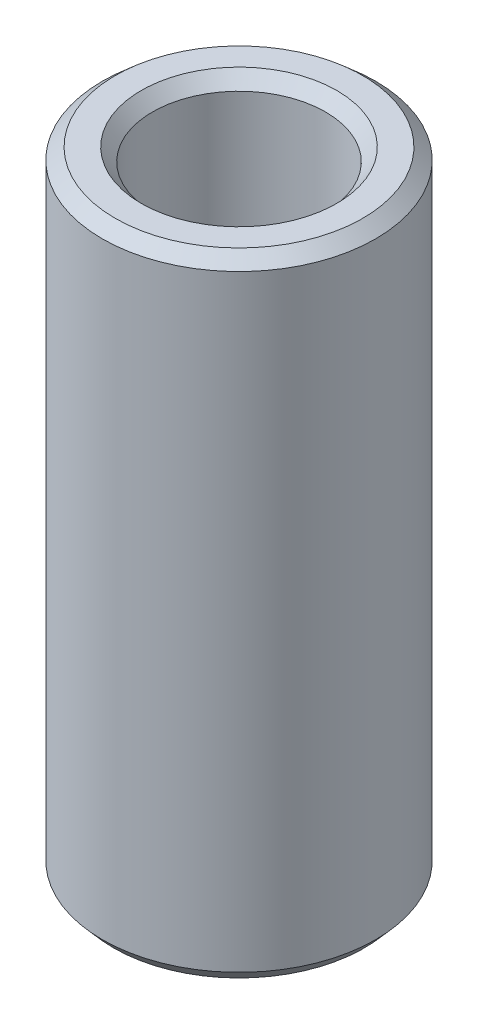
from build123d import *
from OCP.BRepFilletAPI import BRepFilletAPI_MakeChamfer

# Parameters (mm, degrees)
SKETCH1_R           = 47.5
BOSS_EXTRUDE1_DEPTH = 219.440858252
SKETCH2_R           = 30.078602804
CUT_EXTRUDE1_DEPTH  = 230.492462339
CHAMFER1_SIZE       = 3.9352616
CHAMFER1_SIZE2      = 4.482066112


with BuildPart() as part:
    # Sketch1 → Boss-Extrude1 (new body)
    with BuildSketch(Plane(origin=(0, 0, 0), x_dir=(1, 0, 0), z_dir=(0, 1, 0))):
        Circle(SKETCH1_R)
    extrude(amount=BOSS_EXTRUDE1_DEPTH)

    # Sketch2 → Cut-Extrude1 (cut, through all)
    with BuildSketch(Plane(origin=(0, 0, 0), x_dir=(1, 0, 0), z_dir=(0, 1, 0))):
        Circle(SKETCH2_R)
    extrude(amount=CUT_EXTRUDE1_DEPTH, mode=Mode.SUBTRACT)

    # Chamfer1: one chamfer whose edges measure the first distance from different faces: ONE call of the kernel's chamfer builder (chamfer() names one face for all edges)
    chamfer1_edges_1 = [part.edges().sort_by_distance(p)[0] for p in [
        (-30.078602804, 219.440858252, 0),
    ]]
    chamfer1_side_1 = [part.faces().sort_by_distance(p)[0] for p in [
        (-46.156497116, 219.440858252, 0),
    ]]
    chamfer1_edges_2 = [part.edges().sort_by_distance(p)[0] for p in [
        (-30.078602804, 0, 0),
    ]]
    chamfer1_side_2 = [part.faces().sort_by_distance(p)[0] for p in [
        (-30.078602804, 109.720429126, 0),
    ]]
    chamfer1_edges_3 = [part.edges().sort_by_distance(p)[0] for p in [
        (-47.5, 0, 0),
    ]]
    chamfer1_side_3 = [part.faces().sort_by_distance(p)[0] for p in [
        (-46.156497116, 0, 0),
    ]]
    chamfer1_edges_4 = [part.edges().sort_by_distance(p)[0] for p in [
        (-47.5, 219.440858252, 0),
    ]]
    chamfer1_side_4 = [part.faces().sort_by_distance(p)[0] for p in [
        (-47.5, 109.720429126, 0),
    ]]
    chamfer1 = BRepFilletAPI_MakeChamfer(part.part.solid().wrapped)
    for e in chamfer1_edges_1:
        chamfer1.Add(CHAMFER1_SIZE, CHAMFER1_SIZE2, e.wrapped, chamfer1_side_1[0].wrapped)  # the first distance lies on this face
    for e in chamfer1_edges_2:
        chamfer1.Add(CHAMFER1_SIZE, CHAMFER1_SIZE2, e.wrapped, chamfer1_side_2[0].wrapped)  # the first distance lies on this face
    for e in chamfer1_edges_3:
        chamfer1.Add(CHAMFER1_SIZE, CHAMFER1_SIZE2, e.wrapped, chamfer1_side_3[0].wrapped)  # the first distance lies on this face
    for e in chamfer1_edges_4:
        chamfer1.Add(CHAMFER1_SIZE, CHAMFER1_SIZE2, e.wrapped, chamfer1_side_4[0].wrapped)  # the first distance lies on this face
    add(Compound.cast(chamfer1.Shape()), mode=Mode.REPLACE)


solid = part.part
